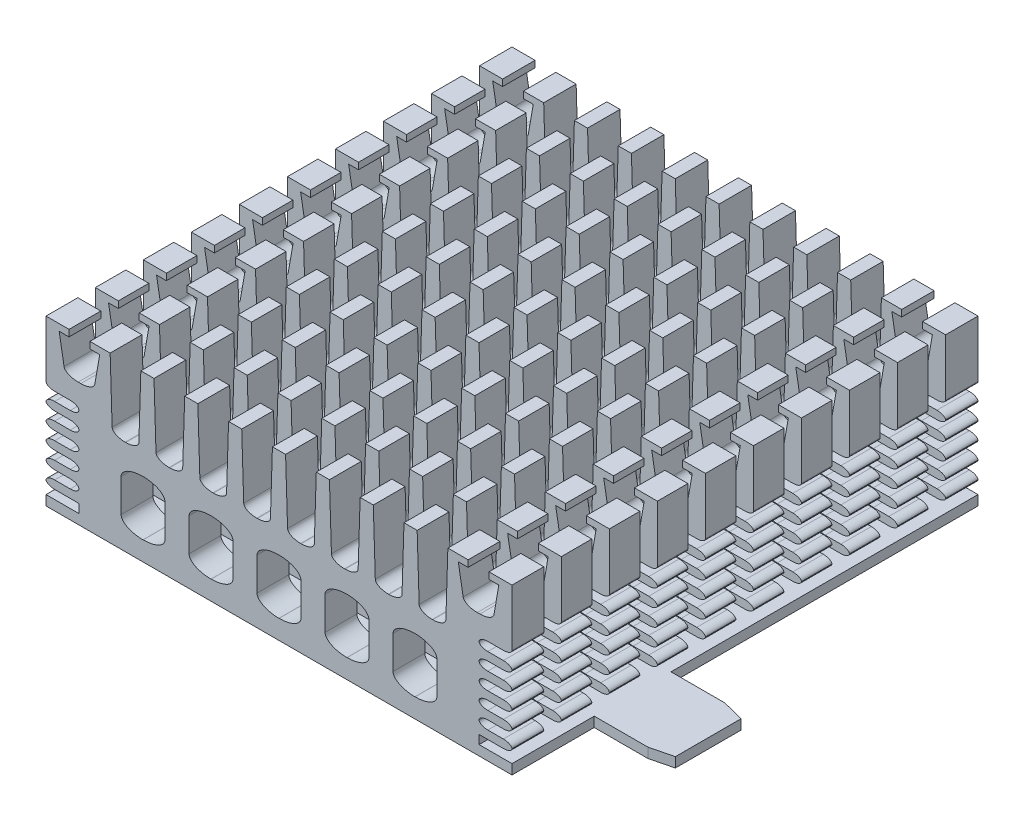
from build123d import *

# Parameters (mm, degrees)
CROQUIS3_W            = 42.5
CROQUIS3_H            = 42.5
EXTRUIR1_DEPTH        = 30
CORTAR_EXTRUIR1_DEPTH = 55
CROQUIS5_W            = 3.649717514
CROQUIS5_H            = 1.6
CORTAR_EXTRUIR2_DEPTH = 55
REDONDEO1_R           = 0.79
REDONDEO2_R           = 0.79
CORTAR_EXTRUIR3_DEPTH = 55
CROQUIS8_W            = 1.6
CROQUIS8_H            = 30.052187853
CORTAR_EXTRUIR4_DEPTH = 55
CROQUIS9_W            = 6.9
CROQUIS9_H            = 7
EXTRUIR2_DEPTH        = 1.8
CHAFL_N1_SIZE         = 0.5
CHAFL_N1_SIZE2        = 2.005390467
CHAFL_N2_SIZE         = 0.5
CHAFL_N2_SIZE2        = 2.005390467
CHAFL_N3_SIZE         = 0.5
CHAFL_N3_SIZE2        = 2.005390467
CHAFL_N4_SIZE         = 0.5
CHAFL_N4_SIZE2        = 2.005390467
SCALE1_SCALE_X        = 0.5
SCALE1_SCALE_Y        = 0.25
SCALE1_SCALE_Z        = 0.5


with BuildPart() as part:
    # Croquis3 → Extruir1 (new body)
    with BuildSketch(Plane(origin=(0, 0, 0), x_dir=(1, 0, 0), z_dir=(0, 1, 0))):
        Rectangle(CROQUIS3_W, CROQUIS3_H)
    extrude(amount=EXTRUIR1_DEPTH)

    # Croquis4 → Cortar-Extruir1 (cut)
    with BuildSketch(Plane.XY.offset(21.25)):
        with BuildLine():
            Line((-19.15, 30), (-19.15, 28.8))
            Line((-19.15, 28.8), (-20.05, 28.8))
            Line((-20.05, 28.8), (-19.60282448, 23.677807681))
            ThreePointArc((-19.60282448, 23.677807681), (-19.189312121, 22.838993141), (-18.317712468, 22.5))
            Line((-18.317712468, 22.5), (-18.082287532, 22.5))
            ThreePointArc((-18.082287532, 22.5), (-17.210687879, 22.838993141), (-16.79717552, 23.677807681))
            Line((-16.79717552, 23.677807681), (-16.35, 28.8))
            Line((-16.35, 28.8), (-17.25, 28.8))
            Line((-17.25, 28.8), (-17.25, 30))
            Line((-17.25, 30), (-19.15, 30))
        make_face()
        with BuildLine():
            Line((-0.6, 30), (-0.781554927, 18.471262166))
            ThreePointArc((-0.781554927, 18.471262166), (-1.136601435, 17.641943981), (-1.971407394, 17.3))
            Line((-1.971407394, 17.3), (-2.028592606, 17.3))
            ThreePointArc((-2.028592606, 17.3), (-2.863398565, 17.641943981), (-3.218445073, 18.471262166))
            Line((-3.218445073, 18.471262166), (-3.4, 30))
            Line((-3.4, 30), (-0.6, 30))
        make_face()
        with BuildLine():
            Line((17.25, 30), (19.15, 30))
            Line((19.15, 30), (19.15, 28.8))
            Line((19.15, 28.8), (20.05, 28.8))
            Line((20.05, 28.8), (19.60282448, 23.677807681))
            ThreePointArc((19.60282448, 23.677807681), (19.189312121, 22.838993141), (18.317712468, 22.5))
            Line((18.317712468, 22.5), (18.082287532, 22.5))
            ThreePointArc((18.082287532, 22.5), (17.210687879, 22.838993141), (16.79717552, 23.677807681))
            Line((16.79717552, 23.677807681), (16.35, 28.8))
            Line((16.35, 28.8), (17.25, 28.8))
            Line((17.25, 28.8), (17.25, 30))
        make_face()
        with BuildLine():
            Line((-4.6, 30), (-4.781554927, 18.471262166))
            ThreePointArc((-4.781554927, 18.471262166), (-5.136601435, 17.641943981), (-5.971407394, 17.3))
            Line((-5.971407394, 17.3), (-6.028592606, 17.3))
            ThreePointArc((-6.028592606, 17.3), (-6.863398565, 17.641943981), (-7.218445073, 18.471262166))
            Line((-7.218445073, 18.471262166), (-7.4, 30))
            Line((-7.4, 30), (-4.6, 30))
        make_face()
        with BuildLine():
            Line((-8.6, 30), (-8.781554927, 18.471262166))
            ThreePointArc((-8.781554927, 18.471262166), (-9.136601435, 17.641943981), (-9.971407394, 17.3))
            Line((-9.971407394, 17.3), (-10.028592606, 17.3))
            ThreePointArc((-10.028592606, 17.3), (-10.863398565, 17.641943981), (-11.218445073, 18.471262166))
            Line((-11.218445073, 18.471262166), (-11.4, 30))
            Line((-11.4, 30), (-8.6, 30))
        make_face()
        with BuildLine():
            Line((-12.6, 30), (-12.781554927, 18.471262166))
            ThreePointArc((-12.781554927, 18.471262166), (-13.136601435, 17.641943981), (-13.971407394, 17.3))
            Line((-13.971407394, 17.3), (-14.028592606, 17.3))
            ThreePointArc((-14.028592606, 17.3), (-14.863398565, 17.641943981), (-15.218445073, 18.471262166))
            Line((-15.218445073, 18.471262166), (-15.4, 30))
            Line((-15.4, 30), (-12.6, 30))
        make_face()
        with BuildLine():
            Line((15.4, 30), (12.6, 30))
            Line((12.6, 30), (12.781554927, 18.471262166))
            ThreePointArc((12.781554927, 18.471262166), (13.136601435, 17.641943981), (13.971407394, 17.3))
            Line((13.971407394, 17.3), (14.028592606, 17.3))
            ThreePointArc((14.028592606, 17.3), (14.863398565, 17.641943981), (15.218445073, 18.471262166))
            Line((15.218445073, 18.471262166), (15.4, 30))
        make_face()
        with BuildLine():
            Line((11.4, 30), (8.6, 30))
            Line((8.6, 30), (8.781554927, 18.471262166))
            ThreePointArc((8.781554927, 18.471262166), (9.136601435, 17.641943981), (9.971407394, 17.3))
            Line((9.971407394, 17.3), (10.028592606, 17.3))
            ThreePointArc((10.028592606, 17.3), (10.863398565, 17.641943981), (11.218445073, 18.471262166))
            Line((11.218445073, 18.471262166), (11.4, 30))
        make_face()
        with BuildLine():
            Line((7.4, 30), (4.6, 30))
            Line((4.6, 30), (4.781554927, 18.471262166))
            ThreePointArc((4.781554927, 18.471262166), (5.136601435, 17.641943981), (5.971407394, 17.3))
            Line((5.971407394, 17.3), (6.028592606, 17.3))
            ThreePointArc((6.028592606, 17.3), (6.863398565, 17.641943981), (7.218445073, 18.471262166))
            Line((7.218445073, 18.471262166), (7.4, 30))
        make_face()
        with BuildLine():
            Line((3.4, 30), (0.6, 30))
            Line((0.6, 30), (0.781554927, 18.471262166))
            ThreePointArc((0.781554927, 18.471262166), (1.136601435, 17.641943981), (1.971407394, 17.3))
            Line((1.971407394, 17.3), (2.028592606, 17.3))
            ThreePointArc((2.028592606, 17.3), (2.863398565, 17.641943981), (3.218445073, 18.471262166))
            Line((3.218445073, 18.471262166), (3.4, 30))
        make_face()
    extrude(amount=-CORTAR_EXTRUIR1_DEPTH, mode=Mode.SUBTRACT)

    # Croquis5 → Cortar-Extruir2 (cut)
    with BuildSketch(Plane.XY.offset(21.25)):
        with Locations((-20.074858757, 18.1)):
            Rectangle(CROQUIS5_W, CROQUIS5_H)
        with Locations((-20.074858757, 15)):
            Rectangle(CROQUIS5_W, CROQUIS5_H)
        with Locations((-20.074858757, 11.9)):
            Rectangle(CROQUIS5_W, CROQUIS5_H)
        with Locations((-20.074858757, 8.8)):
            Rectangle(CROQUIS5_W, CROQUIS5_H)
        with Locations((-20.074858757, 5.7)):
            Rectangle(CROQUIS5_W, CROQUIS5_H)
        with Locations((-20.074858757, 2.6)):
            Rectangle(CROQUIS5_W, CROQUIS5_H)
        with Locations((20.074858757, 2.6)):
            Rectangle(CROQUIS5_W, CROQUIS5_H)
        with Locations((20.074858757, 5.7)):
            Rectangle(CROQUIS5_W, CROQUIS5_H)
        with Locations((20.074858757, 8.8)):
            Rectangle(CROQUIS5_W, CROQUIS5_H)
        with Locations((20.074858757, 11.9)):
            Rectangle(CROQUIS5_W, CROQUIS5_H)
        with Locations((20.074858757, 15)):
            Rectangle(CROQUIS5_W, CROQUIS5_H)
        with Locations((20.074858757, 18.1)):
            Rectangle(CROQUIS5_W, CROQUIS5_H)
    extrude(amount=-CORTAR_EXTRUIR2_DEPTH, mode=Mode.SUBTRACT)

    # Redondeo1
    # the kernel refuses this fillet: 0.79 mm, written as the material it adds along each edge
    with BuildSketch(Plane(origin=(-18.25, 18.9, 21.25), x_dir=(-1, 0, 0), z_dir=(0, 0, -1)), Plane(origin=(-18.25, 17.3, 21.25), x_dir=(0, 1, 0), z_dir=(0, 0, -1)), Plane(origin=(-18.25, 15.8, 21.25), x_dir=(-1, 0, 0), z_dir=(0, 0, -1)), Plane(origin=(-18.25, 14.2, 21.25), x_dir=(0, 1, 0), z_dir=(0, 0, -1)), Plane(origin=(-18.25, 12.7, 21.25), x_dir=(-1, 0, 0), z_dir=(0, 0, -1)), Plane(origin=(-18.25, 11.1, 21.25), x_dir=(0, 1, 0), z_dir=(0, 0, -1)), Plane(origin=(-18.25, 9.6, 21.25), x_dir=(-1, 0, 0), z_dir=(0, 0, -1)), Plane(origin=(-18.25, 8, 21.25), x_dir=(0, 1, 0), z_dir=(0, 0, -1)), Plane(origin=(-18.25, 6.5, 21.25), x_dir=(-1, 0, 0), z_dir=(0, 0, -1)), Plane(origin=(-18.25, 4.9, 21.25), x_dir=(0, 1, 0), z_dir=(0, 0, -1))) as redondeo1_piece_1:
        with BuildLine():
            CenterArc((REDONDEO1_R, -REDONDEO1_R), REDONDEO1_R, 90, 90)
            Line((0, -REDONDEO1_R), (0, 0))
            Line((0, 0), (REDONDEO1_R, 0))
        make_face()
    extrude(amount=42.5)
    # the kernel refuses this fillet: 0.79 mm, written as the material it takes off along each edge
    with BuildSketch(Plane(origin=(-21.25, 18.9, -23.225), x_dir=(0, 1, 0), z_dir=(0, 0, 1)), Plane(origin=(-21.25, 15.8, -23.225), x_dir=(0, 1, 0), z_dir=(0, 0, 1)), Plane(origin=(-21.25, 12.7, -23.225), x_dir=(0, 1, 0), z_dir=(0, 0, 1)), Plane(origin=(-21.25, 9.6, -23.225), x_dir=(0, 1, 0), z_dir=(0, 0, 1)), Plane(origin=(-21.25, 6.5, -23.225), x_dir=(0, 1, 0), z_dir=(0, 0, 1)), Plane(origin=(-21.25, 3.4, -23.225), x_dir=(0, 1, 0), z_dir=(0, 0, 1))) as redondeo1_2_piece_1:
        with BuildLine():
            CenterArc((REDONDEO1_R, -REDONDEO1_R), REDONDEO1_R, 90, 90)
            Line((0, -REDONDEO1_R), (0, 0))
            Line((0, 0), (REDONDEO1_R, 0))
        make_face()
    extrude(amount=46.45, mode=Mode.SUBTRACT)
    with BuildSketch(Plane(origin=(-21.25, 17.3, 23.225), x_dir=(1, 0, 0), z_dir=(0, 0, -1)), Plane(origin=(-21.25, 14.2, 23.225), x_dir=(1, 0, 0), z_dir=(0, 0, -1)), Plane(origin=(-21.25, 11.1, 23.225), x_dir=(1, 0, 0), z_dir=(0, 0, -1)), Plane(origin=(-21.25, 8, 23.225), x_dir=(1, 0, 0), z_dir=(0, 0, -1)), Plane(origin=(-21.25, 4.9, 23.225), x_dir=(1, 0, 0), z_dir=(0, 0, -1))) as redondeo1_2_piece_2:
        with BuildLine():
            CenterArc((REDONDEO1_R, REDONDEO1_R), REDONDEO1_R, 180, 90)
            Line((0, REDONDEO1_R), (0, 0))
            Line((0, 0), (REDONDEO1_R, 0))
        make_face()
    extrude(amount=46.45, mode=Mode.SUBTRACT)

    # Redondeo2
    # the kernel refuses this fillet: 0.79 mm, written as the material it adds along each edge
    with BuildSketch(Plane(origin=(18.25, 6.5, 21.25), x_dir=(1, 0, 0), z_dir=(0, 0, -1)), Plane(origin=(18.25, 4.9, 21.25), x_dir=(0, 1, 0), z_dir=(0, 0, -1)), Plane(origin=(18.25, 9.6, 21.25), x_dir=(1, 0, 0), z_dir=(0, 0, -1)), Plane(origin=(18.25, 8, 21.25), x_dir=(0, 1, 0), z_dir=(0, 0, -1)), Plane(origin=(18.25, 12.7, 21.25), x_dir=(1, 0, 0), z_dir=(0, 0, -1)), Plane(origin=(18.25, 11.1, 21.25), x_dir=(0, 1, 0), z_dir=(0, 0, -1)), Plane(origin=(18.25, 15.8, 21.25), x_dir=(1, 0, 0), z_dir=(0, 0, -1)), Plane(origin=(18.25, 14.2, 21.25), x_dir=(0, 1, 0), z_dir=(0, 0, -1)), Plane(origin=(18.25, 18.9, 21.25), x_dir=(1, 0, 0), z_dir=(0, 0, -1)), Plane(origin=(18.25, 17.3, 21.25), x_dir=(0, 1, 0), z_dir=(0, 0, -1))) as redondeo2_piece_1:
        with BuildLine():
            CenterArc((REDONDEO2_R, REDONDEO2_R), REDONDEO2_R, 180, 90)
            Line((0, REDONDEO2_R), (0, 0))
            Line((0, 0), (REDONDEO2_R, 0))
        make_face()
    extrude(amount=42.5)
    # the kernel refuses this fillet: 0.79 mm, written as the material it takes off along each edge
    with BuildSketch(Plane(origin=(21.25, 3.4, -23.225), x_dir=(0, 1, 0), z_dir=(0, 0, 1)), Plane(origin=(21.25, 6.5, -23.225), x_dir=(0, 1, 0), z_dir=(0, 0, 1)), Plane(origin=(21.25, 9.6, -23.225), x_dir=(0, 1, 0), z_dir=(0, 0, 1)), Plane(origin=(21.25, 12.7, -23.225), x_dir=(0, 1, 0), z_dir=(0, 0, 1)), Plane(origin=(21.25, 15.8, -23.225), x_dir=(0, 1, 0), z_dir=(0, 0, 1)), Plane(origin=(21.25, 18.9, -23.225), x_dir=(0, 1, 0), z_dir=(0, 0, 1))) as redondeo2_2_piece_1:
        with BuildLine():
            CenterArc((REDONDEO2_R, REDONDEO2_R), REDONDEO2_R, 180, 90)
            Line((0, REDONDEO2_R), (0, 0))
            Line((0, 0), (REDONDEO2_R, 0))
        make_face()
    extrude(amount=46.45, mode=Mode.SUBTRACT)
    with BuildSketch(Plane(origin=(21.25, 4.9, 23.225), x_dir=(-1, 0, 0), z_dir=(0, 0, -1)), Plane(origin=(21.25, 8, 23.225), x_dir=(-1, 0, 0), z_dir=(0, 0, -1)), Plane(origin=(21.25, 11.1, 23.225), x_dir=(-1, 0, 0), z_dir=(0, 0, -1)), Plane(origin=(21.25, 14.2, 23.225), x_dir=(-1, 0, 0), z_dir=(0, 0, -1)), Plane(origin=(21.25, 17.3, 23.225), x_dir=(-1, 0, 0), z_dir=(0, 0, -1))) as redondeo2_2_piece_2:
        with BuildLine():
            CenterArc((REDONDEO2_R, -REDONDEO2_R), REDONDEO2_R, 90, 90)
            Line((0, -REDONDEO2_R), (0, 0))
            Line((0, 0), (REDONDEO2_R, 0))
        make_face()
    extrude(amount=46.45, mode=Mode.SUBTRACT)

    # Croquis7 → Cortar-Extruir3 (cut)
    with BuildSketch(Plane.XY.offset(21.25)):
        with BuildLine():
            Line((-0.01, 13.5), (0.01, 13.5))
            ThreePointArc((0.01, 13.5), (1.417142495, 12.917142495), (2, 11.51))
            Line((2, 11.51), (2, 5.49))
            ThreePointArc((2, 5.49), (1.417142495, 4.082857505), (0.01, 3.5))
            Line((0.01, 3.5), (-0.01, 3.5))
            ThreePointArc((-0.01, 3.5), (-1.417142495, 4.082857505), (-2, 5.49))
            Line((-2, 5.49), (-2, 11.51))
            ThreePointArc((-2, 11.51), (-1.417142495, 12.917142495), (-0.01, 13.5))
        make_face()
        with BuildLine():
            Line((6.19, 13.5), (6.21, 13.5))
            ThreePointArc((6.21, 13.5), (7.617142495, 12.917142495), (8.2, 11.51))
            Line((8.2, 11.51), (8.2, 5.49))
            ThreePointArc((8.2, 5.49), (7.617142495, 4.082857505), (6.21, 3.5))
            Line((6.21, 3.5), (6.19, 3.5))
            ThreePointArc((6.19, 3.5), (4.782857505, 4.082857505), (4.2, 5.49))
            Line((4.2, 5.49), (4.2, 11.51))
            ThreePointArc((4.2, 11.51), (4.782857505, 12.917142495), (6.19, 13.5))
        make_face()
        with BuildLine():
            Line((12.39, 13.5), (12.41, 13.5))
            ThreePointArc((12.41, 13.5), (13.817142495, 12.917142495), (14.4, 11.51))
            Line((14.4, 11.51), (14.4, 5.49))
            ThreePointArc((14.4, 5.49), (13.817142495, 4.082857505), (12.41, 3.5))
            Line((12.41, 3.5), (12.39, 3.5))
            ThreePointArc((12.39, 3.5), (10.982857505, 4.082857505), (10.4, 5.49))
            Line((10.4, 5.49), (10.4, 11.51))
            ThreePointArc((10.4, 11.51), (10.982857505, 12.917142495), (12.39, 13.5))
        make_face()
        with BuildLine():
            Line((-14.4, 11.51), (-14.4, 5.49))
            ThreePointArc((-14.4, 5.49), (-13.817142495, 4.082857505), (-12.41, 3.5))
            Line((-12.41, 3.5), (-12.39, 3.5))
            ThreePointArc((-12.39, 3.5), (-10.982857505, 4.082857505), (-10.4, 5.49))
            Line((-10.4, 5.49), (-10.4, 11.51))
            ThreePointArc((-10.4, 11.51), (-10.982857505, 12.917142495), (-12.39, 13.5))
            Line((-12.39, 13.5), (-12.41, 13.5))
            ThreePointArc((-12.41, 13.5), (-13.817142495, 12.917142495), (-14.4, 11.51))
        make_face()
        with BuildLine():
            Line((-8.2, 11.51), (-8.2, 5.49))
            ThreePointArc((-8.2, 5.49), (-7.617142495, 4.082857505), (-6.21, 3.5))
            Line((-6.21, 3.5), (-6.19, 3.5))
            ThreePointArc((-6.19, 3.5), (-4.782857505, 4.082857505), (-4.2, 5.49))
            Line((-4.2, 5.49), (-4.2, 11.51))
            ThreePointArc((-4.2, 11.51), (-4.782857505, 12.917142495), (-6.19, 13.5))
            Line((-6.19, 13.5), (-6.21, 13.5))
            ThreePointArc((-6.21, 13.5), (-7.617142495, 12.917142495), (-8.2, 11.51))
        make_face()
    extrude(amount=-CORTAR_EXTRUIR3_DEPTH, mode=Mode.SUBTRACT)

    # Croquis8 → Cortar-Extruir4 (cut)
    with BuildSketch(Plane(origin=(21.25, 0, 0), x_dir=(0, 0, -1), z_dir=(1, 0, 0))):
        with Locations((-17.55, 17.526093926)):
            Rectangle(CROQUIS8_W, CROQUIS8_H)
        with Locations((-13.17, 17.526093926)):
            Rectangle(CROQUIS8_W, CROQUIS8_H)
        with Locations((-8.79, 17.526093926)):
            Rectangle(CROQUIS8_W, CROQUIS8_H)
        with Locations((-4.41, 17.526093926)):
            Rectangle(CROQUIS8_W, CROQUIS8_H)
        with Locations((-0.03, 17.526093926)):
            Rectangle(CROQUIS8_W, CROQUIS8_H)
        with Locations((4.35, 17.526093926)):
            Rectangle(CROQUIS8_W, CROQUIS8_H)
        with Locations((8.73, 17.526093926)):
            Rectangle(CROQUIS8_W, CROQUIS8_H)
        with Locations((13.11, 17.526093926)):
            Rectangle(CROQUIS8_W, CROQUIS8_H)
        with Locations((17.49, 17.526093926)):
            Rectangle(CROQUIS8_W, CROQUIS8_H)
    extrude(amount=-CORTAR_EXTRUIR4_DEPTH, mode=Mode.SUBTRACT)

    # Croquis9 → Extruir2 (add)
    with BuildSketch(Plane.XZ):
        with Locations((-24.7, -10.25)):
            Rectangle(CROQUIS9_W, CROQUIS9_H)
        with Locations((24.7, 10.25)):
            Rectangle(CROQUIS9_W, CROQUIS9_H)
    extrude(amount=-EXTRUIR2_DEPTH)

    # Chaflán1
    chafl_n1_edges = [part.edges().sort_by_distance(p)[0] for p in [
        (28.15, 0.9, 13.75),
    ]]
    chafl_n1_side = [part.faces().sort_by_distance(p)[0] for p in [
        (28.15, 0.9, 10.25),
    ]]
    chamfer(chafl_n1_edges, length=CHAFL_N1_SIZE, length2=CHAFL_N1_SIZE2, reference=chafl_n1_side[0])

    # Chaflán2
    chafl_n2_edges = [part.edges().sort_by_distance(p)[0] for p in [
        (28.15, 0.9, 6.75),
    ]]
    chafl_n2_side = [part.faces().sort_by_distance(p)[0] for p in [
        (28.15, 0.9, 10),
    ]]
    chamfer(chafl_n2_edges, length=CHAFL_N2_SIZE, length2=CHAFL_N2_SIZE2, reference=chafl_n2_side[0])

    # Chaflán3
    chafl_n3_edges = [part.edges().sort_by_distance(p)[0] for p in [
        (-28.15, 0.9, -6.75),
    ]]
    chafl_n3_side = [part.faces().sort_by_distance(p)[0] for p in [
        (-28.15, 0.9, -10.25),
    ]]
    chamfer(chafl_n3_edges, length=CHAFL_N3_SIZE, length2=CHAFL_N3_SIZE2, reference=chafl_n3_side[0])

    # Chaflán4
    chafl_n4_edges = [part.edges().sort_by_distance(p)[0] for p in [
        (-28.15, 0.9, -13.75),
    ]]
    chafl_n4_side = [part.faces().sort_by_distance(p)[0] for p in [
        (-28.15, 0.9, -10.5),
    ]]
    chamfer(chafl_n4_edges, length=CHAFL_N4_SIZE, length2=CHAFL_N4_SIZE2, reference=chafl_n4_side[0])


with BuildPart() as part_1:
    # Scale1: scaled about (0, 12.279944369, -0.01225182)
    add(part.part.scale((SCALE1_SCALE_X, SCALE1_SCALE_Y, SCALE1_SCALE_Z), about=(0, 12.279944369, -0.01225182)))


solid = part_1.part
